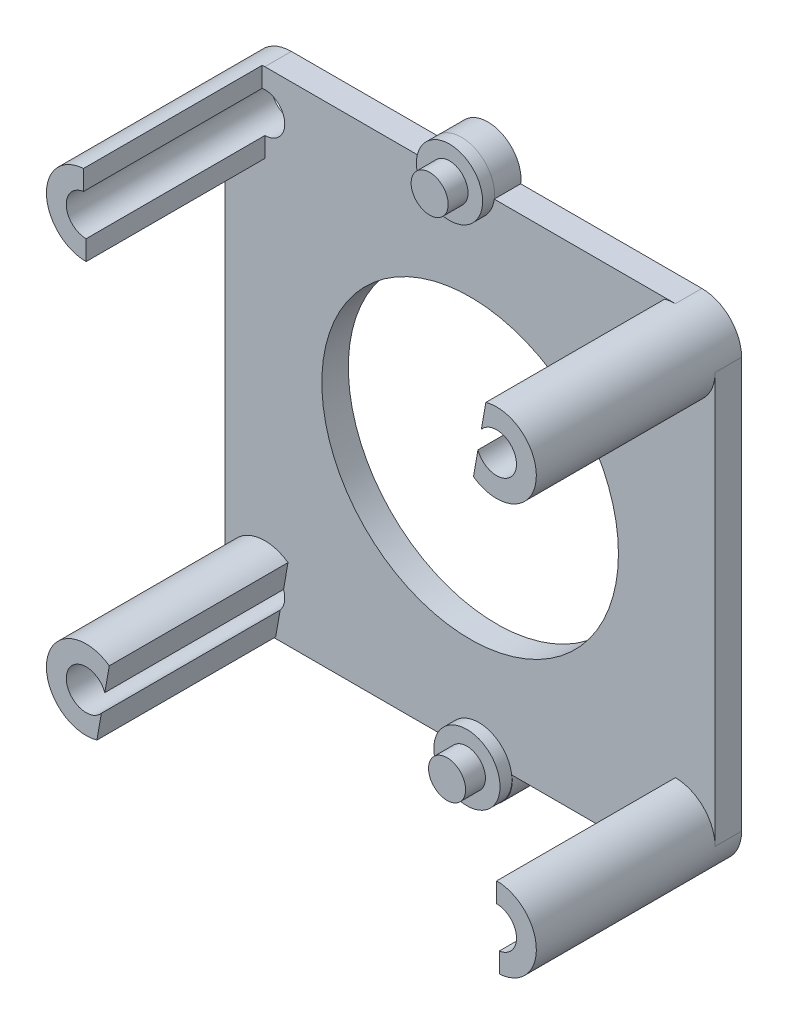
from build123d import *
from build123d.topology import SkipClean

# Parameters (mm, degrees)
SKETCH1_R      = 1.5
SKETCH1_R_2    = 11.2
EXTRUDE1_DEPTH = 2
SKETCH2_R      = 2.5
EXTRUDE2_DEPTH = 0.9
SKETCH3_R      = 1.4
EXTRUDE3_DEPTH = 1.5
EXTRUDE4_DEPTH = 13.5
EXTRUDE5_START = -13.5
EXTRUDE5_DEPTH = 13.5
SKETCH6_W      = 0.2
SKETCH6_H      = 4.339086574
EXTRUDE6_DEPTH = 13.5


with BuildPart() as part:
    # Sketch1 → Extrude1 (new body)
    with BuildSketch(Plane.XY):
        with BuildLine():
            Line((-18.5, 15.5), (-18.5, -15.5))
            ThreePointArc((-18.5, -15.5), (-17.621320344, -17.621320344), (-15.5, -18.5))
            Line((-15.5, -18.5), (-1.853762559, -18.5))
            ThreePointArc((-1.853762559, -18.5), (0.656979507, -21.34366179), (3.167721572, -18.5))
            Line((3.167721572, -18.5), (15.5, -18.5))
            ThreePointArc((15.5, -18.5), (17.621320344, -17.621320344), (18.5, -15.5))
            Line((18.5, -15.5), (18.5, 15.5))
            ThreePointArc((18.5, 15.5), (17.621320344, 17.621320344), (15.5, 18.5))
            Line((15.5, 18.5), (1.819299557, 18.5))
            ThreePointArc((1.819299557, 18.5), (-0.656979507, 21.309467878), (-3.13325857, 18.5))
            Line((-3.13325857, 18.5), (-15.5, 18.5))
            ThreePointArc((-15.5, 18.5), (-17.621320344, 17.621320344), (-18.5, 15.5))
        make_face()
        with Locations((15.5, 15.5)):
            Circle(SKETCH1_R, mode=Mode.SUBTRACT)
        with Locations((-15.5, 15.5)):
            Circle(SKETCH1_R, mode=Mode.SUBTRACT)
        Circle(SKETCH1_R_2, mode=Mode.SUBTRACT)
        with Locations((15.5, -15.5)):
            Circle(SKETCH1_R, mode=Mode.SUBTRACT)
        with Locations((-15.5, -15.5)):
            Circle(SKETCH1_R, mode=Mode.SUBTRACT)
    extrude(amount=EXTRUDE1_DEPTH)

    # Sketch2 → Extrude2 (add)
    with BuildSketch(Plane.XY.offset(2)):
        with Locations((-0.656979507, 18.813431552)):
            Circle(SKETCH2_R)
        with Locations((0.656979507, -18.813431552)):
            Circle(SKETCH2_R)
    extrude(amount=EXTRUDE2_DEPTH)

    # Sketch3 → Extrude3 (add)
    with BuildSketch(Plane.XY.offset(2.9)):
        with Locations((-0.656979507, 18.813431552)):
            Circle(SKETCH3_R)
        with Locations((0.656979507, -18.813431552)):
            Circle(SKETCH3_R)
    extrude(amount=EXTRUDE3_DEPTH)

    # Sketch4 → Extrude4 (add)
    with SkipClean():  # the faces are left unmerged after this step: merging them gives an invalid solid
        with BuildSketch(Plane.XY.offset(2)):
            with BuildLine():
                Line((15.5, -14), (15.5, -12.5))
                ThreePointArc((15.5, -12.5), (18.5, -15.5), (15.5, -18.5))
                Line((15.5, -18.5), (15.5, -17))
                ThreePointArc((15.5, -17), (17, -15.5), (15.5, -14))
            make_face()
            with BuildLine():
                Line((-14.897310813, -12.561162518), (-15.198655407, -14.030581259))
                ThreePointArc((-15.198655407, -14.030581259), (-16.969418741, -15.198655407), (-15.801344593, -16.969418741))
                Line((-15.801344593, -16.969418741), (-16.102689187, -18.438837482))
                ThreePointArc((-16.102689187, -18.438837482), (-18.438837482, -14.897310813), (-14.897310813, -12.561162518))
            make_face()
            with BuildLine():
                Line((-15.5, 17), (-15.5, 18.5))
                ThreePointArc((-15.5, 18.5), (-18.5, 15.5), (-15.5, 12.5))
                Line((-15.5, 12.5), (-15.5, 14))
                ThreePointArc((-15.5, 14), (-17, 15.5), (-15.5, 17))
            make_face()
            with BuildLine():
                Line((16.102689187, 18.438837482), (15.801344593, 16.969418741))
                ThreePointArc((15.801344593, 16.969418741), (16.969418741, 15.198655407), (15.198655407, 14.030581259))
                Line((15.198655407, 14.030581259), (14.897310813, 12.561162518))
                ThreePointArc((14.897310813, 12.561162518), (18.438837482, 14.897310813), (16.102689187, 18.438837482))
            make_face()
        extrude(amount=EXTRUDE4_DEPTH)

    # Sketch5 → Extrude5 (add)
    with SkipClean():  # the faces are left unmerged after this step: merging them gives an invalid solid
        with BuildSketch(Plane.XY.offset(15.5).offset(EXTRUDE5_START)):
            with BuildLine():
                Line((14.684749395, 18.387103471), (14.348199746, 16.460914239))
                ThreePointArc((14.348199746, 16.460914239), (16.977615135, 15.241826583), (14.090600687, 14.98658635))
                Line((14.090600687, 14.98658635), (13.754051037, 13.060397118))
                ThreePointArc((13.754051037, 13.060397118), (18.45523027, 14.983653166), (14.684749395, 18.387103471))
            make_face()
            with BuildLine():
                Line((-13.754051037, -13.060397118), (-14.090600687, -14.98658635))
                ThreePointArc((-14.090600687, -14.98658635), (-16.977615135, -15.241826583), (-14.348199746, -16.460914239))
                Line((-14.348199746, -16.460914239), (-14.684749395, -18.387103471))
                ThreePointArc((-14.684749395, -18.387103471), (-18.45523027, -14.983653166), (-13.754051037, -13.060397118))
            make_face()
        extrude(amount=EXTRUDE5_DEPTH)

    # Sketch6 → Extrude6 (cut)
    with SkipClean():  # the faces are left unmerged after this step: merging them gives an invalid solid
        with BuildSketch(Plane.XY.offset(15.5)):
            Polygon((-15.5, 19.617766956), (-15.5, 15.861892736), (-15.7, 15.875), (-15.7, 19.617766956), align=None)
            with Locations((15.6, -18.094430424)):
                Rectangle(SKETCH6_W, SKETCH6_H)
        extrude(amount=-EXTRUDE6_DEPTH, mode=Mode.SUBTRACT)


solid = part.part
